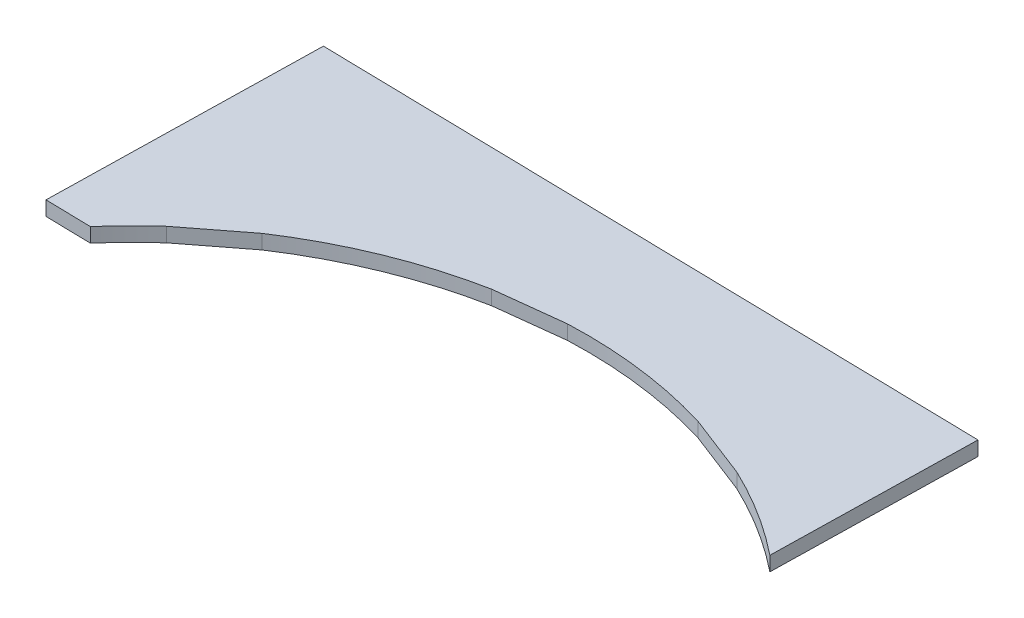
from build123d import *

# Parameters (mm, degrees)
BOSS_EXTRUDE1_DEPTH = 6.35


with BuildPart() as part:
    # Sketch1 → Boss-Extrude1 (new body)
    with BuildSketch(Plane(origin=(0, 0, 0), x_dir=(1, 0, 0), z_dir=(0, 1, 0))):
        with BuildLine():
            Line((-12.884325045, 57.589892951), (-32.880086413, 58.0016299))
            Line((-32.880086413, 58.0016299), (-30.409664718, 177.976198108))
            Line((-30.409664718, 177.976198108), (264.52781546, 171.903078107))
            Line((264.52781546, 171.903078107), (262.674606435, 81.903078107))
            ThreePointArc((262.674606435, 81.903078107), (243.855743131, 95.27871358), (223.620762732, 106.396393581))
            Line((223.620762732, 106.396393581), (195.598020496, 117.247831174))
            ThreePointArc((195.598020496, 117.247831174), (162.959720984, 124.22900876), (129.614931972, 125.685195998))
            Line((129.614931972, 125.685195998), (99.614931972, 122.205605467))
            ThreePointArc((99.614931972, 122.205605467), (62.167456158, 111.077020968), (27.597724328, 92.881074194))
            Line((27.597724328, 92.881074194), (3.847059798, 74.546406222))
            ThreePointArc((3.847059798, 74.546406222), (-4.771312567, 66.317474746), (-12.884325045, 57.589892951))
        make_face()
    extrude(amount=BOSS_EXTRUDE1_DEPTH)


solid = part.part
